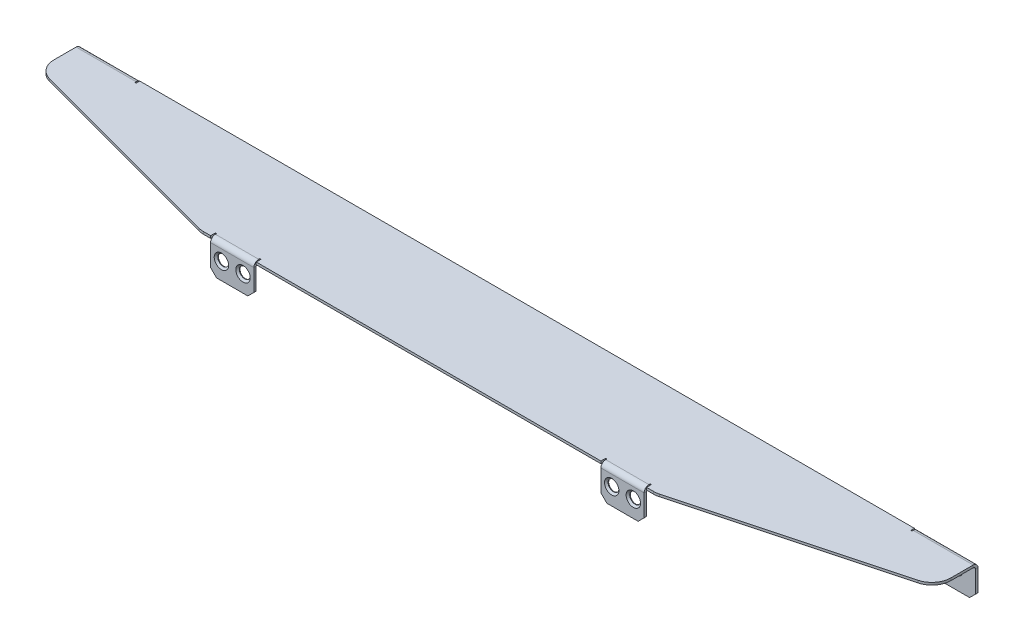
from build123d import *

# Parameters (mm, degrees)
SM_BASE_FLANGE_1_DEPTH            = 2
SM_EDGE_FLANGE_1_STRIP_W          = 12
SM_EDGE_FLANGE_1_STRIP_H          = 2
SM_EDGE_FLANGE_1_STRIP_CUT_DEPTH  = 50
SM_EDGE_FLANGE_1_RELIEF_W         = 13
SM_EDGE_FLANGE_1_RELIEF_H         = 1
SM_EDGE_FLANGE_1_RELIEF_CUT_DEPTH = 2
SM_EDGE_FLANGE_1_DEPTH            = 50
SM_EDGE_FLANGE_2_STRIP_W          = 12
SM_EDGE_FLANGE_2_STRIP_H          = 2
SM_EDGE_FLANGE_2_STRIP_CUT_DEPTH  = 50
SM_EDGE_FLANGE_2_RELIEF_W         = 13
SM_EDGE_FLANGE_2_RELIEF_H         = 1
SM_EDGE_FLANGE_2_RELIEF_CUT_DEPTH = 2
SM_EDGE_FLANGE_2_DEPTH            = 50
SM_EDGE_FLANGE_3_STRIP_W          = 13
SM_EDGE_FLANGE_3_STRIP_H          = 2
SM_EDGE_FLANGE_3_STRIP_CUT_DEPTH  = 36
SM_EDGE_FLANGE_3_RELIEF_W         = 14
SM_EDGE_FLANGE_3_RELIEF_H         = 1
SM_EDGE_FLANGE_3_RELIEF_CUT_DEPTH = 2
SM_EDGE_FLANGE_3_DEPTH            = 36
SM_EDGE_FLANGE_4_STRIP_W          = 13
SM_EDGE_FLANGE_4_STRIP_H          = 2
SM_EDGE_FLANGE_4_STRIP_CUT_DEPTH  = 36
SM_EDGE_FLANGE_4_RELIEF_W         = 14
SM_EDGE_FLANGE_4_RELIEF_H         = 1
SM_EDGE_FLANGE_4_RELIEF_CUT_DEPTH = 2
SM_EDGE_FLANGE_4_DEPTH            = 36
CHAMFER_1_SIZE                    = 5
HOLE_WIZARD_M61_AT_2_COUNT        = 2
HOLE_WIZARD_M61_AT_2_PITCH        = 18
HOLE_WIZARD_M61_AT_3_COUNT        = 2
HOLE_WIZARD_M61_AT_3_PITCH        = 325
HOLE_WIZARD_M61_AT_4_COUNT        = 2
HOLE_WIZARD_M61_AT_4_PITCH        = 343
SKETCH_20_R                       = 2.5
CUT_EXTRUDE_1_DEPTH               = 2
SKETCH_21_W                       = 645
SKETCH_21_H                       = 2
CUT_EXTRUDE_2_DEPTH               = 2


# Sheet-metal steps are written as plain solids
with BuildPart() as part:
    # Sketch 1 → Базовая кромка1 (new body)
    with BuildSketch(Plane(origin=(0, 0, 0), x_dir=(1, 0, 0), z_dir=(0, 1, 0))):
        with BuildLine():
            Line((-187.5, 0), (187.5, 0))
            ThreePointArc((187.5, 0), (189.588419076, 0.136882218), (191.641104722, 0.545186779))
            Line((191.641104722, 0.545186779), (361.641104722, 46.096549493))
            ThreePointArc((361.641104722, 46.096549493), (370.193653445, 51.811179849), (373.5, 61.551362713))
            Line((373.5, 61.551362713), (373.5, 84))
            Line((373.5, 84), (0, 84))
            Line((0, 84), (-373.5, 84))
            Line((-373.5, 84), (-373.5, 61.551362713))
            ThreePointArc((-373.5, 61.551362713), (-370.193653445, 51.811179849), (-361.641104722, 46.096549493))
            Line((-361.641104722, 46.096549493), (-191.641104722, 0.545186779))
            ThreePointArc((-191.641104722, 0.545186779), (-189.588419076, 0.136882218), (-187.5, 0))
        make_face()
    extrude(amount=SM_BASE_FLANGE_1_DEPTH)

    # Ребро-кромка1 strip (across the edge) → Ребро-кромка1 strip cut (cut)
    with BuildSketch(Plane(origin=(323.5, 0, -84), x_dir=(0, 0, 1), z_dir=(1, 0, 0))):
        with Locations((-2, -1)):
            Rectangle(SM_EDGE_FLANGE_1_STRIP_W, SM_EDGE_FLANGE_1_STRIP_H)
    extrude(amount=SM_EDGE_FLANGE_1_STRIP_CUT_DEPTH, mode=Mode.SUBTRACT)

    # Ребро-кромка1 relief (on the sheet) → Ребро-кромка1 relief cut (cut)
    with BuildSketch(Plane(origin=(323.5, 0, -80), x_dir=(0, 0, 1), z_dir=(0, -1, 0))):
        with Locations((-5.5, 0.5)):
            Rectangle(SM_EDGE_FLANGE_1_RELIEF_W, SM_EDGE_FLANGE_1_RELIEF_H)
    extrude(amount=-SM_EDGE_FLANGE_1_RELIEF_CUT_DEPTH, mode=Mode.SUBTRACT)

    # Ребро-кромка1 section (across the edge) → Ребро-кромка1 (add)
    with BuildSketch(Plane(origin=(323.5, 0, -84), x_dir=(0, 0, 1), z_dir=(1, 0, 0))):
        with BuildLine():
            Line((0, 2), (0, 25))
            Line((0, 25), (2, 25))
            Line((2, 25), (2, 2))
            ThreePointArc((2, 2), (2.585786438, 0.585786438), (4, 0))
            Line((4, 0), (4, -2))
            ThreePointArc((4, -2), (1.171572875, -0.828427125), (0, 2))
        make_face()
    extrude(amount=SM_EDGE_FLANGE_1_DEPTH)

    # Ребро-кромка2 strip (across the edge) → Ребро-кромка2 strip cut (cut)
    with BuildSketch(Plane(origin=(-373.5, 0, -84), x_dir=(0, 0, 1), z_dir=(1, 0, 0))):
        with Locations((-2, -1)):
            Rectangle(SM_EDGE_FLANGE_2_STRIP_W, SM_EDGE_FLANGE_2_STRIP_H)
    extrude(amount=SM_EDGE_FLANGE_2_STRIP_CUT_DEPTH, mode=Mode.SUBTRACT)

    # Ребро-кромка2 relief (on the sheet) → Ребро-кромка2 relief cut (cut)
    with BuildSketch(Plane(origin=(-373.5, 0, -80), x_dir=(0, 0, 1), z_dir=(0, -1, 0))):
        with Locations((-5.5, -50.5)):
            Rectangle(SM_EDGE_FLANGE_2_RELIEF_W, SM_EDGE_FLANGE_2_RELIEF_H)
    extrude(amount=-SM_EDGE_FLANGE_2_RELIEF_CUT_DEPTH, mode=Mode.SUBTRACT)

    # Ребро-кромка2 section (across the edge) → Ребро-кромка2 (add)
    with BuildSketch(Plane(origin=(-373.5, 0, -84), x_dir=(0, 0, 1), z_dir=(1, 0, 0))):
        with BuildLine():
            Line((0, 2), (0, 25))
            Line((0, 25), (2, 25))
            Line((2, 25), (2, 2))
            ThreePointArc((2, 2), (2.585786438, 0.585786438), (4, 0))
            Line((4, 0), (4, -2))
            ThreePointArc((4, -2), (1.171572875, -0.828427125), (0, 2))
        make_face()
    extrude(amount=SM_EDGE_FLANGE_2_DEPTH)

    # Ребро-кромка3 strip (across the edge) → Ребро-кромка3 strip cut (cut)
    with BuildSketch(Plane(origin=(-144.5, 0, 1), x_dir=(0, 0, -1), z_dir=(-1, 0, 0))):
        with Locations((-2.5, -1)):
            Rectangle(SM_EDGE_FLANGE_3_STRIP_W, SM_EDGE_FLANGE_3_STRIP_H)
    extrude(amount=SM_EDGE_FLANGE_3_STRIP_CUT_DEPTH, mode=Mode.SUBTRACT)

    # Ребро-кромка3 relief (on the sheet) → Ребро-кромка3 relief cut (cut)
    with BuildSketch(Plane(origin=(-144.5, 0, -3), x_dir=(0, 0, -1), z_dir=(0, -1, 0))):
        with Locations((-6, 0.5)):
            Rectangle(SM_EDGE_FLANGE_3_RELIEF_W, SM_EDGE_FLANGE_3_RELIEF_H)
        with Locations((-6, -36.5)):
            Rectangle(SM_EDGE_FLANGE_3_RELIEF_W, SM_EDGE_FLANGE_3_RELIEF_H)
    extrude(amount=-SM_EDGE_FLANGE_3_RELIEF_CUT_DEPTH, mode=Mode.SUBTRACT)

    # Ребро-кромка3 section (across the edge) → Ребро-кромка3 (add)
    with BuildSketch(Plane(origin=(-144.5, 0, 1), x_dir=(0, 0, -1), z_dir=(-1, 0, 0))):
        with BuildLine():
            Line((0, 2), (0, 25))
            Line((0, 25), (2, 25))
            Line((2, 25), (2, 2))
            ThreePointArc((2, 2), (2.585786438, 0.585786438), (4, 0))
            Line((4, 0), (4, -2))
            ThreePointArc((4, -2), (1.171572875, -0.828427125), (0, 2))
        make_face()
    extrude(amount=SM_EDGE_FLANGE_3_DEPTH)

    # Ребро-кромка4 strip (across the edge) → Ребро-кромка4 strip cut (cut)
    with BuildSketch(Plane(origin=(180.5, 0, 1), x_dir=(0, 0, -1), z_dir=(-1, 0, 0))):
        with Locations((-2.5, -1)):
            Rectangle(SM_EDGE_FLANGE_4_STRIP_W, SM_EDGE_FLANGE_4_STRIP_H)
    extrude(amount=SM_EDGE_FLANGE_4_STRIP_CUT_DEPTH, mode=Mode.SUBTRACT)

    # Ребро-кромка4 relief (on the sheet) → Ребро-кромка4 relief cut (cut)
    with BuildSketch(Plane(origin=(180.5, 0, -3), x_dir=(0, 0, -1), z_dir=(0, -1, 0))):
        with Locations((-6, 0.5)):
            Rectangle(SM_EDGE_FLANGE_4_RELIEF_W, SM_EDGE_FLANGE_4_RELIEF_H)
        with Locations((-6, -36.5)):
            Rectangle(SM_EDGE_FLANGE_4_RELIEF_W, SM_EDGE_FLANGE_4_RELIEF_H)
    extrude(amount=-SM_EDGE_FLANGE_4_RELIEF_CUT_DEPTH, mode=Mode.SUBTRACT)

    # Ребро-кромка4 section (across the edge) → Ребро-кромка4 (add)
    with BuildSketch(Plane(origin=(180.5, 0, 1), x_dir=(0, 0, -1), z_dir=(-1, 0, 0))):
        with BuildLine():
            Line((0, 2), (0, 25))
            Line((0, 25), (2, 25))
            Line((2, 25), (2, 2))
            ThreePointArc((2, 2), (2.585786438, 0.585786438), (4, 0))
            Line((4, 0), (4, -2))
            ThreePointArc((4, -2), (1.171572875, -0.828427125), (0, 2))
        make_face()
    extrude(amount=SM_EDGE_FLANGE_4_DEPTH)

    # Фаска1
    chamfer_1_edges = [part.edges().sort_by_distance(p)[0] for p in [
        (-373.5, -25, -83),
        (-323.5, -25, -83),
        (-144.5, -25, 0),
        (-180.5, -25, 0),
        (180.5, -25, 0),
        (144.5, -25, 0),
        (323.5, -25, -83),
        (373.5, -25, -83),
    ]]
    chamfer(chamfer_1_edges, length=CHAMFER_1_SIZE)

    # Эскиз18 → Зенковка для винта с потайной головкой M61 (revolve, cut)
    with BuildSketch(Plane(origin=(-171.5, -11, 1), x_dir=(0, -1, 0), z_dir=(1, 0, 0))):
        Polygon((0, 0), (0, 2), (4.5, 2), (4.5, 1.5), (6, 0), align=None)
    hole_wizard_m61 = revolve(axis=Axis((-171.5, -11, 7.35), (0, 0, -1)), mode=Mode.SUBTRACT)

    # Зенковка для винта с потайной головкой M61 at 2: Зенковка для винта с потайной головкой M61 ×2
    with Locations(*[(i * HOLE_WIZARD_M61_AT_2_PITCH, 0, 0) for i in range(1, HOLE_WIZARD_M61_AT_2_COUNT)]):
        add(hole_wizard_m61, mode=Mode.SUBTRACT)

    # Зенковка для винта с потайной головкой M61 at 3: Зенковка для винта с потайной головкой M61 ×2
    with Locations(*[(i * HOLE_WIZARD_M61_AT_3_PITCH, 0, 0) for i in range(1, HOLE_WIZARD_M61_AT_3_COUNT)]):
        add(hole_wizard_m61, mode=Mode.SUBTRACT)

    # Зенковка для винта с потайной головкой M61 at 4: Зенковка для винта с потайной головкой M61 ×2
    with Locations(*[(i * HOLE_WIZARD_M61_AT_4_PITCH, 0, 0) for i in range(1, HOLE_WIZARD_M61_AT_4_COUNT)]):
        add(hole_wizard_m61, mode=Mode.SUBTRACT)

    # Эскиз20 → Вытянуть1 (cut)
    with BuildSketch(Plane(origin=(0, 0, -84), x_dir=(-1, 0, 0), z_dir=(0, 0, -1))):
        with Locations(Location((337.5, -11, 0), (0, 0, 90))):
            Circle(SKETCH_20_R)
        with Locations(Location((359.5, -11, 0), (0, 0, 90))):
            Circle(SKETCH_20_R)
        with Locations(Location((-359.5, -11, 0), (0, 0, 270))):
            Circle(SKETCH_20_R)
        with Locations(Location((-337.5, -11, 0), (0, 0, 270))):
            Circle(SKETCH_20_R)
    extrude(amount=-CUT_EXTRUDE_1_DEPTH, mode=Mode.SUBTRACT)

    # Эскиз21 → Вытянуть2 (cut)
    with BuildSketch(Plane(origin=(0, 0, -84), x_dir=(-1, 0, 0), z_dir=(0, 0, -1))):
        with Locations((0, 1)):
            Rectangle(SKETCH_21_W, SKETCH_21_H)
    extrude(amount=-CUT_EXTRUDE_2_DEPTH, mode=Mode.SUBTRACT)


solid = part.part
